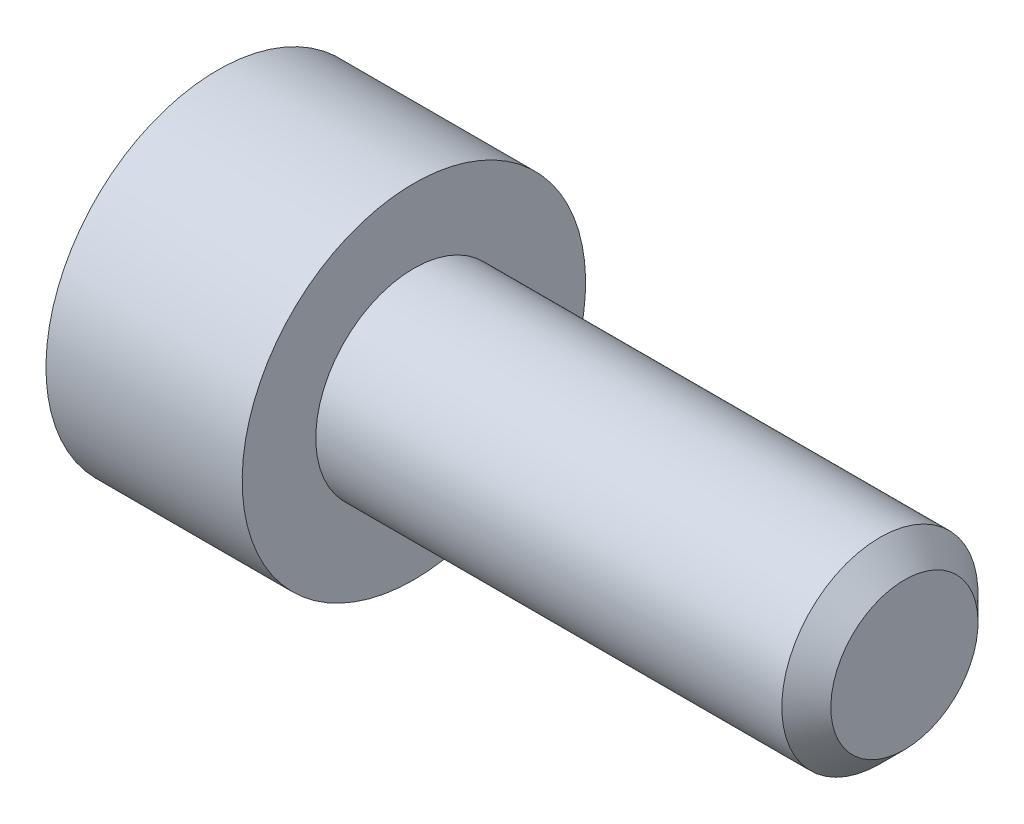
from build123d import *

# Parameters (mm, degrees)
CUT_EXTRUDE_1_DEPTH = 2


with BuildPart() as part:
    # 草圖1 → 旋轉1 (revolve)
    with BuildSketch(Plane.XY):
        Polygon((-4, 0), (-4, 3.5), (0, 3.5), (0, 2), (9.5, 2), (10, 1.5), (10, 0), align=None)
    revolve(axis=Axis((10, 0, 0), (-1, 0, 0)))

    # 草圖2 → 除料-旋轉1 (revolve, cut)
    with BuildSketch(Plane.XY):
        Polygon((-4, 0), (-4, 1.5), (-2, 1.5), (-1.598076211, 0), align=None)
    revolve(axis=Axis((-1.598076211, 0, 0), (-1, 0, 0)), mode=Mode.SUBTRACT)

    # 草圖3 → 除料-伸長1 (cut)
    with BuildSketch(Plane(origin=(-4, 0, 0), x_dir=(0, 0, -1), z_dir=(1, 0, 0))):
        Polygon((-1.5, 0.866025404), (-1.5, -0.866025404), (0, -1.732050808), (1.5, -0.866025404), (1.5, 0.866025404), (0, 1.732050808), align=None)
    extrude(amount=CUT_EXTRUDE_1_DEPTH, mode=Mode.SUBTRACT)


solid = part.part
